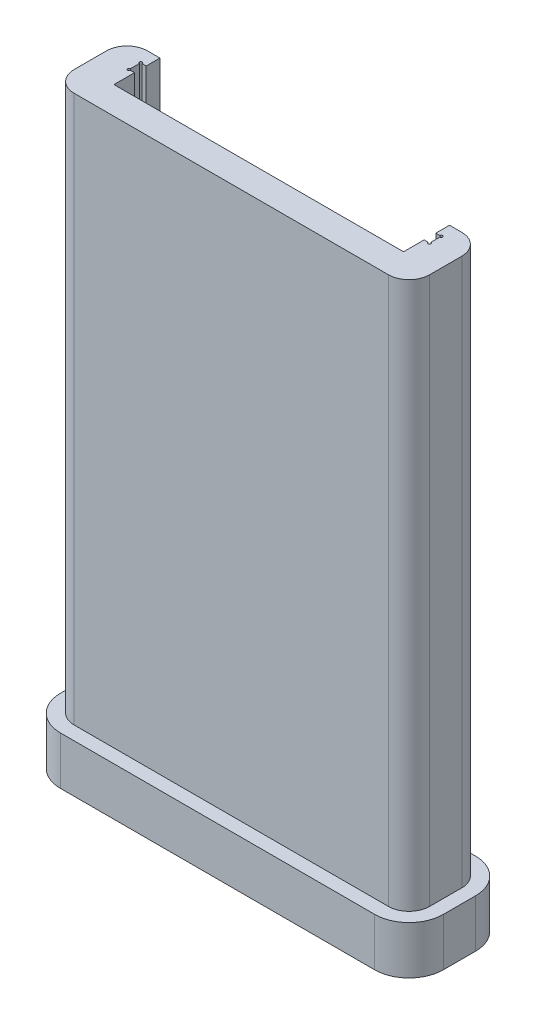
from build123d import *

# Parameters (mm, degrees)
SKETCH2_W               = 88.9
SKETCH2_H               = 152.4
BOSS_EXTRUDE1_DEPTH     = 5.9944
CUT_EXTRUDE2_DEPTH      = 177.535840076
CUT_EXTRUDE2_DEPTH_BACK = 177.535840076
SKETCH4_R               = 2.7305
BOSS_EXTRUDE2_DEPTH     = 101.6
FILLET1_R               = 3.81
CUT_EXTRUDE3_DEPTH      = 204.596488182
CUT_EXTRUDE3_DEPTH_BACK = 204.596488182
SKETCH7_W               = 2.54
SKETCH7_H               = 152.4
SKETCH11_W              = 86.36
SKETCH11_H              = 152.4
CUT_EXTRUDE4_DEPTH      = 6.35
BOSS_EXTRUDE3_DEPTH     = 8.89
SKETCH13_R              = 2.7305
CUT_EXTRUDE5_DEPTH      = 6.35


with BuildPart() as part:
    # Sketch2 → Boss-Extrude1 (new body)
    with BuildSketch(Plane(origin=(0, 0, 0), x_dir=(1, 0, 0), z_dir=(0, 1, 0))):
        with Locations((44.45, 76.2)):
            Rectangle(SKETCH2_W, SKETCH2_H)
    extrude(amount=BOSS_EXTRUDE1_DEPTH)

    # Sketch4 → Cut-Extrude2 (cut, two sides: drawn at the far end of the back side and taken through both)
    with BuildSketch(Plane(origin=(0, 5.9944, 0), x_dir=(1, 0, 0), z_dir=(0, 1, 0)).offset(-CUT_EXTRUDE2_DEPTH_BACK)):
        with Locations((45.72, 109.871331367)):
            Circle(SKETCH4_R)
        with Locations((45.72, 33.671331367)):
            Circle(SKETCH4_R)
    extrude(amount=CUT_EXTRUDE2_DEPTH + CUT_EXTRUDE2_DEPTH_BACK, mode=Mode.SUBTRACT)

    # Sketch5 → Boss-Extrude2 (add)
    with BuildSketch(Plane(origin=(0, 5.9944, 0), x_dir=(1, 0, 0), z_dir=(0, 1, 0))):
        with BuildLine():
            Line((17.653, 16.129), (11.557, 16.129))
            Line((11.557, 16.129), (11.557, 2.54))
            Line((11.557, 2.54), (77.343, 2.54))
            Line((77.343, 2.54), (77.343, 16.129))
            Line((77.343, 16.129), (71.247, 16.129))
            Line((71.247, 16.129), (71.247, 13.589))
            Line((71.247, 13.589), (72.009, 13.589))
            ThreePointArc((72.009, 13.589), (72.263, 13.843), (72.517, 13.589))
            ThreePointArc((72.517, 13.589), (72.442605122, 13.409394878), (72.263, 13.335))
            Line((72.263, 13.335), (72.263, 11.684))
            ThreePointArc((72.263, 11.684), (72.442605122, 11.609605122), (72.517, 11.43))
            ThreePointArc((72.517, 11.43), (72.263, 11.176), (72.009, 11.43))
            Line((72.009, 11.43), (71.247, 11.43))
            Line((71.247, 11.43), (71.247, 7.62))
            Line((71.247, 7.62), (17.653, 7.62))
            Line((17.653, 7.62), (17.653, 11.43))
            Line((17.653, 11.43), (16.891, 11.43))
            ThreePointArc((16.891, 11.43), (16.457394878, 11.250394878), (16.637, 11.684))
            Line((16.637, 11.684), (16.637, 13.335))
            ThreePointArc((16.637, 13.335), (16.457394878, 13.768605122), (16.891, 13.589))
            Line((16.891, 13.589), (17.653, 13.589))
            Line((17.653, 13.589), (17.653, 16.129))
        make_face()
    extrude(amount=BOSS_EXTRUDE2_DEPTH)

    # Fillet1
    fillet1_edges = [part.edges().sort_by_distance(p)[0] for p in [
        (11.557, 56.7944, -2.54),
        (11.557, 56.7944, -16.129),
        (77.343, 56.7944, -2.54),
        (77.343, 56.7944, -16.129),
    ]]
    fillet(fillet1_edges, radius=FILLET1_R)

    # Sketch7 → Cut-Extrude3 (cut, two sides: drawn at the far end of the back side and taken through both)
    with BuildSketch(Plane(origin=(0, 5.9944, 0), x_dir=(1, 0, 0), z_dir=(0, 1, 0)).offset(-CUT_EXTRUDE3_DEPTH_BACK)):
        with Locations((1.27, 76.2)):
            Rectangle(SKETCH7_W, SKETCH7_H)
    extrude(amount=CUT_EXTRUDE3_DEPTH + CUT_EXTRUDE3_DEPTH_BACK, mode=Mode.SUBTRACT)

    # Sketch11 → Cut-Extrude4 (cut)
    with BuildSketch(Plane.XZ):
        with Locations((45.72, -76.2)):
            Rectangle(SKETCH11_W, SKETCH11_H)
    extrude(amount=-CUT_EXTRUDE4_DEPTH, mode=Mode.SUBTRACT)

    # Sketch12 → Boss-Extrude3 (add)
    with BuildSketch(Plane.XZ.offset(-6.35)):
        with BuildLine():
            ThreePointArc((73.533, -18.669), (78.023128061, -16.809128061), (79.883, -12.319))
            Line((79.883, -12.319), (79.883, -6.35))
            ThreePointArc((79.883, -6.35), (78.023128061, -1.859871939), (73.533, 0))
            Line((73.533, 0), (15.367, 0))
            ThreePointArc((15.367, 0), (10.876871939, -1.859871939), (9.017, -6.35))
            Line((9.017, -6.35), (9.017, -12.319))
            ThreePointArc((9.017, -12.319), (10.876871939, -16.809128061), (15.367, -18.669))
            Line((15.367, -18.669), (73.533, -18.669))
        make_face()
    extrude(amount=BOSS_EXTRUDE3_DEPTH)

    # Sketch13 → Cut-Extrude5 (cut)
    with BuildSketch(Plane.XZ.offset(2.54)):
        with Locations((19.05, -9.3345)):
            Circle(SKETCH13_R)
        with Locations((69.85, -9.3345)):
            Circle(SKETCH13_R)
    extrude(amount=-CUT_EXTRUDE5_DEPTH, mode=Mode.SUBTRACT)


solid = part.part
